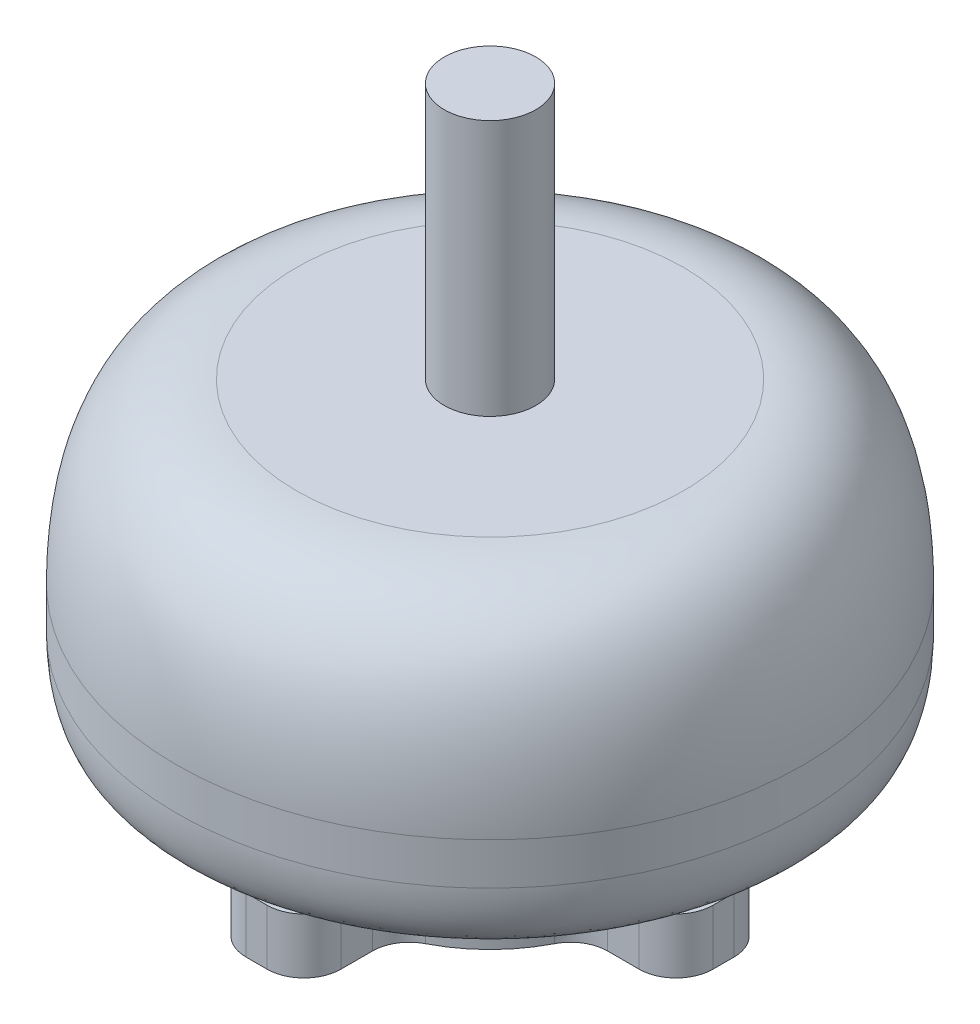
from build123d import *

# Parameters (mm, degrees)
SKETCH1_R                = 8.03
SKETCH1_R_2              = 6.26
BOSS_EXTRUDE1_DEPTH      = 3
SKETCH1_4_R              = 1.21
BOSS_EXTRUDE3_DEPTH      = 3
FILLET1_R                = 2
CIRPATTERN1_COUNT        = 4
FILLET1_OF_CIRPATTERN1_R = 2
BOSS_EXTRUDE4_START      = 3
SKETCH1_5_R              = 7.145
SKETCH1_5_R_2            = 6.26
SKETCH1_5_R_3            = 2.475
BOSS_EXTRUDE4_DEPTH      = 3.2
BOSS_EXTRUDE5_START      = 6.2
SKETCH1_6_R              = 16.97
BOSS_EXTRUDE5_DEPTH      = 14.85
BOSS_EXTRUDE6_START      = 21.05
SKETCH1_7_R              = 2.475
BOSS_EXTRUDE6_DEPTH      = 13.86
FILLET3_SIZE             = 3
FILLET3_SIZE_2           = 1


with BuildPart() as part:
    # Sketch1 → Boss-Extrude1 (new body)
    with BuildSketch(Plane(origin=(0, 0, 0), x_dir=(1, 0, 0), z_dir=(0, 1, 0))):
        with Locations(Location((0, 0, 0), (0, 0, 270))):
            Circle(SKETCH1_R)
        with Locations(Location((0, 0, 0), (0, 0, 270))):
            Circle(SKETCH1_R_2, mode=Mode.SUBTRACT)
    extrude(amount=BOSS_EXTRUDE1_DEPTH)

    # Sketch1<4> → Boss-Extrude3 (add)
    with BuildSketch(Plane(origin=(0, 0, 0), x_dir=(1, 0, 0), z_dir=(0, 1, 0))):
        with BuildLine():
            Line((-2.565, 12.63), (-2.565, 7.609315015))
            ThreePointArc((-2.565, 7.609315015), (0, 8.03), (2.565, 7.609315015))
            Line((2.565, 7.609315015), (2.565, 12.63))
            Line((2.565, 12.63), (-2.565, 12.63))
        make_face()
        with Locations(Location((0, 9.57, 0), (0, 0, 270))):
            Circle(SKETCH1_4_R, mode=Mode.SUBTRACT)
    boss_extrude3 = extrude(amount=BOSS_EXTRUDE3_DEPTH)

    # Fillet1
    fillet1_edges = [part.edges().sort_by_distance(p)[0] for p in [
        (-2.565, 1.5, -7.609315015),
        (2.565, 1.5, -7.609315015),
        (2.565, 1.5, -12.63),
        (-2.565, 1.5, -12.63),
    ]]
    fillet(fillet1_edges, radius=FILLET1_R)

    # CirPattern1: Boss-Extrude3 ×4 about axis
    cirpattern1_axis = Axis((0, 0, 0), (0, 1, 0))
    for i in range(1, CIRPATTERN1_COUNT):
        add(boss_extrude3.rotate(cirpattern1_axis, i * 360 / CIRPATTERN1_COUNT))

    # Fillet1 of CirPattern1
    fillet1_of_cirpattern1_edges = [part.edges().sort_by_distance(p)[0] for p in [
        (-7.609315015, 1.5, 2.565),
        (-7.609315015, 1.5, -2.565),
        (-12.63, 1.5, -2.565),
        (-12.63, 1.5, 2.565),
        (2.565, 1.5, 7.609315015),
        (-2.565, 1.5, 7.609315015),
        (-2.565, 1.5, 12.63),
        (2.565, 1.5, 12.63),
        (7.609315015, 1.5, -2.565),
        (7.609315015, 1.5, 2.565),
        (12.63, 1.5, 2.565),
        (12.63, 1.5, -2.565),
    ]]
    fillet(fillet1_of_cirpattern1_edges, radius=FILLET1_OF_CIRPATTERN1_R)

    # Sketch1<5> → Boss-Extrude4 (add)
    # profile 1 of 3: a face of its own
    with BuildSketch(Plane(origin=(0, 0, 0), x_dir=(1, 0, 0), z_dir=(0, 1, 0)).offset(BOSS_EXTRUDE4_START)):
        with Locations(Location((0, 0, 0), (0, 0, 270))):
            Circle(SKETCH1_5_R)
        with Locations(Location((0, 0, 0), (0, 0, 270))):
            Circle(SKETCH1_5_R_2, mode=Mode.SUBTRACT)
    # profile 2 of 3: a face of its own
    with BuildSketch(Plane(origin=(0, 0, 0), x_dir=(1, 0, 0), z_dir=(0, 1, 0)).offset(BOSS_EXTRUDE4_START)):
        with Locations(Location((0, 0, 0), (0, 0, 270))):
            Circle(SKETCH1_5_R_2)
        Circle(SKETCH1_5_R_3, mode=Mode.SUBTRACT)
    # profile 3 of 3: a face of its own
    with BuildSketch(Plane(origin=(0, 0, 0), x_dir=(1, 0, 0), z_dir=(0, 1, 0)).offset(BOSS_EXTRUDE4_START)):
        Circle(SKETCH1_5_R_3)
    extrude(amount=BOSS_EXTRUDE4_DEPTH)

    # Sketch1<6> → Boss-Extrude5 (add)
    with BuildSketch(Plane(origin=(0, 0, 0), x_dir=(1, 0, 0), z_dir=(0, 1, 0)).offset(BOSS_EXTRUDE5_START)):
        with Locations(Location((0, 0, 0), (0, 0, 270))):
            Circle(SKETCH1_6_R)
    extrude(amount=BOSS_EXTRUDE5_DEPTH)

    # Sketch1<7> → Boss-Extrude6 (add)
    with BuildSketch(Plane(origin=(0, 0, 0), x_dir=(1, 0, 0), z_dir=(0, 1, 0)).offset(BOSS_EXTRUDE6_START)):
        with Locations(Location((0, 0, 0), (0, 0, 90))):
            Circle(SKETCH1_7_R)
    extrude(amount=BOSS_EXTRUDE6_DEPTH)

    # Sketch2 → Cut-Revolve2 (revolve, cut)
    with BuildSketch(Plane.XY, mode=Mode.PRIVATE) as cut_revolve2_sk:
        with BuildLine():
            add(Edge.make_bspline(
                [(10.47, 21.05), (15.814758039, 21.05), (16.969999933, 15.844909447), (16.97, 11.464372124)],
                knots=[0, 0, 0, 0, 0.661851635, 0.661851635, 0.661851635, 0.661851635], degree=3))
            Line((16.97, 11.464372124), (16.97, 21.05))
            Line((16.97, 21.05), (10.47, 21.05))
        make_face()
    revolve(cut_revolve2_sk.sketch.rotate(Axis((0, 21.05, 0), (0, -1, 0)), 90), axis=Axis((0, 21.05, 0), (0, -1, 0)), mode=Mode.SUBTRACT)

    # Fillet3
    # an asymmetric fillet: 3, 1 mm, written as the material it takes off along each edge
    with BuildSketch(Plane(origin=(0, 6.2, 0), x_dir=(0, 0, 1), z_dir=(-1, 0, 0))) as fillet3_piece_1:
        with BuildLine():
            Bezier((16.97, FILLET3_SIZE), (16.97, 0), (16.97 - FILLET3_SIZE_2, 0), weights=[1, 0.707106781, 1])
            Line((16.97 - FILLET3_SIZE_2, 0), (16.97, 0))
            Line((16.97, 0), (16.97, FILLET3_SIZE))
        make_face()
    revolve(axis=Axis((0, 6.2, 0), (0, 1, 0)), mode=Mode.SUBTRACT)


solid = part.part
